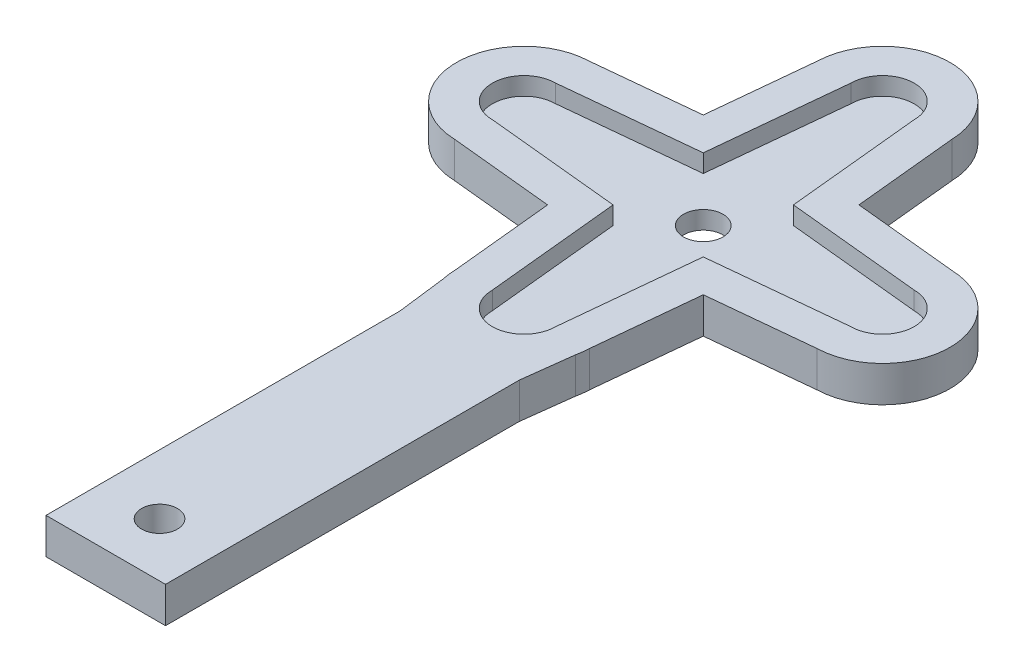
from build123d import *
from build123d.topology import SkipClean

# Parameters (mm, degrees)
SKETCH1_R               = 21
BOSS_EXTRUDE1_DEPTH     = 1.5
SKETCH2_R               = 2.65
CUT_EXTRUDE1_DEPTH      = 1.5
SKETCH5_W               = 10
SKETCH5_H               = 50
BOSS_EXTRUDE2_DEPTH     = 1.5
CIRPATTERN1_DEPTH       = 1.5
CUT_EXTRUDE4_REACH      = 56.252
SKETCH4_R               = 1.65
CUT_EXTRUDE5_REACH      = 56.314
SKETCH6_R               = 1.5
CUT_EXTRUDE6_DEPTH      = 55.251728083
CUT_EXTRUDE6_DEPTH_BACK = 55.251728083


# Read off the part's stored shape, not the designer's step: CirPattern1
with BuildPart() as part:
    # Sketch1 → Boss-Extrude1 (new, symmetric)
    with BuildSketch(Plane(origin=(0, 0, 0), x_dir=(1, 0, 0), z_dir=(0, 1, 0))):
        with Locations(Location((0, 0, 0), (0, 0, 270))):
            Circle(SKETCH1_R)
    extrude(amount=BOSS_EXTRUDE1_DEPTH, both=True)

    # Sketch2 → Cut-Extrude1 (cut)
    with BuildSketch(Plane(origin=(0, 1.5, 0), x_dir=(1, 0, 0), z_dir=(0, 1, 0))):
        with Locations((0, -15)):
            Circle(SKETCH2_R)
        with BuildLine():
            ThreePointArc((-2.65, -15), (0, -12.35), (2.65, -15))
            Line((2.65, -15), (4.067821782, -0.821782178))
            ThreePointArc((4.067821782, -0.821782178), (0, -4.15), (-4.067821782, -0.821782178))
            Line((-4.067821782, -0.821782178), (-2.65, -15))
        make_face()
        with BuildLine():
            ThreePointArc((-4.067821782, -0.821782178), (0, -4.15), (4.067821782, -0.821782178))
            Line((4.067821782, -0.821782178), (4.15, 0))
            ThreePointArc((4.15, 0), (0, 4.15), (-4.15, 0))
            Line((-4.15, 0), (-4.067821782, -0.821782178))
        make_face()
    cut_extrude1 = extrude(amount=-CUT_EXTRUDE1_DEPTH, mode=Mode.SUBTRACT)

    # Sketch5 → Boss-Extrude2 (add, symmetric)
    with BuildSketch(Plane(origin=(0, 0, 0), x_dir=(1, 0, 0), z_dir=(0, 1, 0))):
        with Locations((0, -25)):
            Rectangle(SKETCH5_W, SKETCH5_H)
    extrude(amount=BOSS_EXTRUDE2_DEPTH, both=True)

    # Mirror1: Cut-Extrude1 across plane
    with SkipClean():  # the faces are left unmerged after this step: merging them gives an invalid solid
        add(cut_extrude1.mirror(Plane.XY), mode=Mode.SUBTRACT)

    # CirPattern1 outline → CirPattern1 (cut)
    with BuildSketch(Plane(origin=(0, 0, 0), x_dir=(1, 0, 0), z_dir=(0, 1, 0))):
        with BuildLine():
            Line((3.772727273, -3.772727273), (15, -2.65))
            ThreePointArc((15, -2.65), (17.65, 0), (15, 2.65))
            Line((15, 2.65), (3.772727273, 3.772727273))
            Line((3.772727273, 3.772727273), (4.067821782, 0.821782178))
            ThreePointArc((4.067821782, 0.821782178), (0, -4.15), (-4.067821782, 0.821782178))
            Line((-4.067821782, 0.821782178), (-3.772727273, 3.772727273))
            Line((-3.772727273, 3.772727273), (-15, 2.65))
            ThreePointArc((-15, 2.65), (-17.65, 0), (-15, -2.65))
            Line((-15, -2.65), (-3.772727273, -3.772727273))
            Line((-3.772727273, -3.772727273), (-2.65, -15))
            ThreePointArc((-2.65, -15), (0, -17.65), (2.65, -15))
            Line((2.65, -15), (3.772727273, -3.772727273))
        make_face()
    extrude(amount=CIRPATTERN1_DEPTH, mode=Mode.SUBTRACT)

    # Sketch4 → Cut-Extrude4 (cut, up to next)
    with BuildSketch(Plane(origin=(0, 0, 0), x_dir=(1, 0, 0), z_dir=(0, 1, 0)), mode=Mode.PRIVATE) as cut_extrude4_sk1:
        with Locations(Location((0, 0, 0), (0, 0, 270))):
            Circle(SKETCH4_R)
    cut_extrude4_tool1 = extrude(cut_extrude4_sk1.sketch, amount=-CUT_EXTRUDE4_REACH, mode=Mode.PRIVATE) & part.part
    add(cut_extrude4_tool1.solids().sort_by_distance((0, 0, 0))[0], mode=Mode.SUBTRACT)

    # Sketch6 → Cut-Extrude5 (cut, up to next)
    with BuildSketch(Plane(origin=(0, 1.5, 0), x_dir=(1, 0, 0), z_dir=(0, 1, 0)), mode=Mode.PRIVATE) as cut_extrude5_sk1:
        with Locations(Location((0, -45.5, 0), (0, 0, 270))):
            Circle(SKETCH6_R)
    cut_extrude5_tool1 = extrude(cut_extrude5_sk1.sketch, amount=-CUT_EXTRUDE5_REACH, mode=Mode.PRIVATE) & part.part
    add(cut_extrude5_tool1.solids().sort_by_distance((0, 1.5, 45.5))[0], mode=Mode.SUBTRACT)

    # Sketch7 → Cut-Extrude6 (cut, two sides: drawn at the far end of the back side and taken through both)
    with BuildSketch(Plane(origin=(0, 0, 0), x_dir=(1, 0, 0), z_dir=(0, 1, 0)).offset(-CUT_EXTRUDE6_DEPTH_BACK)):
        with BuildLine():
            ThreePointArc((5, -20.396078054), (0, 21), (-5, -20.396078054))
            Line((-5, -20.396078054), (-5.519486194, -16.207382355))
            ThreePointArc((-5.519486194, -16.207382355), (-5.607043009, -15.695391034), (-5.647210443, -15.177522436))
            Line((-5.647210443, -15.177522436), (-6.513602442, -6.513602442))
            Line((-6.513602442, -6.513602442), (-15.177522436, -5.647210443))
            ThreePointArc((-15.177522436, -5.647210443), (-20.65, 0), (-15.177522436, 5.647210443))
            Line((-15.177522436, 5.647210443), (-6.513602442, 6.513602442))
            Line((-6.513602442, 6.513602442), (-5.647210443, 15.177522436))
            ThreePointArc((-5.647210443, 15.177522436), (0, 20.65), (5.647210443, 15.177522436))
            Line((5.647210443, 15.177522436), (6.513602442, 6.513602442))
            Line((6.513602442, 6.513602442), (15.177522436, 5.647210443))
            ThreePointArc((15.177522436, 5.647210443), (20.65, 0), (15.177522436, -5.647210443))
            Line((15.177522436, -5.647210443), (6.513602442, -6.513602442))
            Line((6.513602442, -6.513602442), (5.647210443, -15.177522436))
            ThreePointArc((5.647210443, -15.177522436), (5.607043009, -15.695391034), (5.519486194, -16.207382355))
            Line((5.519486194, -16.207382355), (5, -20.396078054))
        make_face()
    extrude(amount=CUT_EXTRUDE6_DEPTH + CUT_EXTRUDE6_DEPTH_BACK, mode=Mode.SUBTRACT)


solid = part.part
